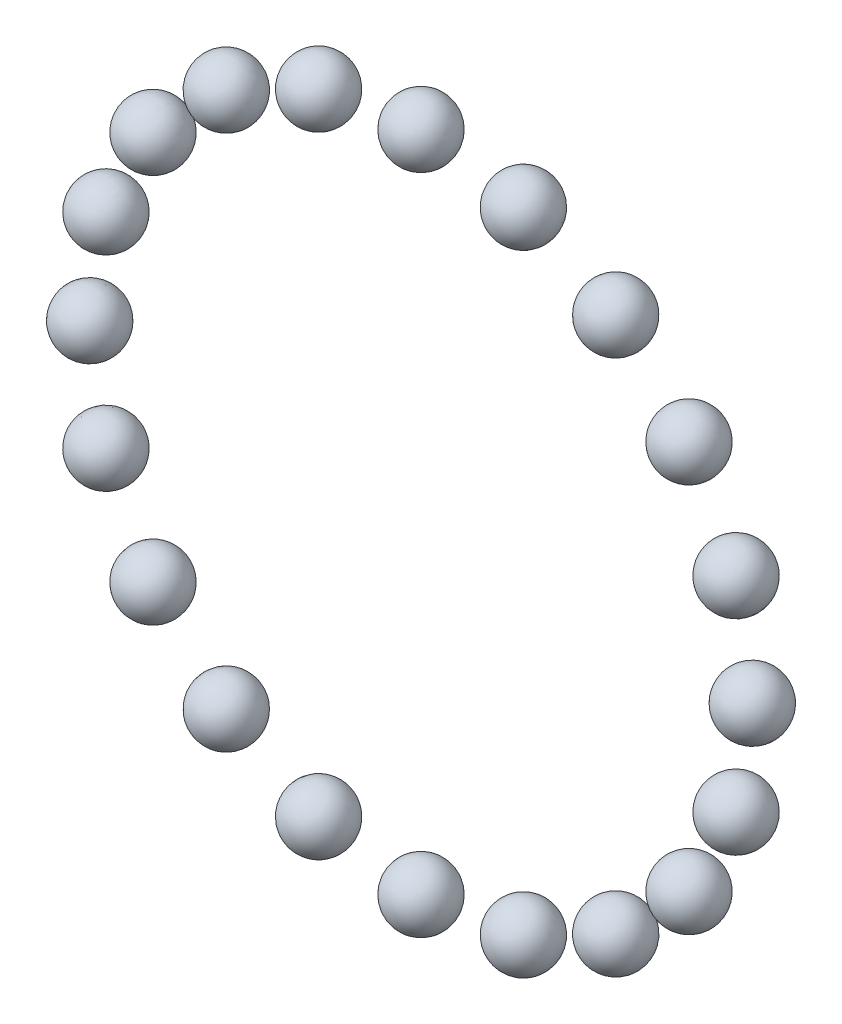
from build123d import *

# Parameters (mm, degrees)
CIRPATTERN1_COUNT = 20


with BuildPart() as part:
    # Sketch2 → Revolve1 (revolve)
    with BuildSketch(Plane.XY):
        with BuildLine():
            ThreePointArc((-29.5, 0), (-32.5, 3), (-35.5, 0))
            Line((-35.5, 0), (-29.5, 0))
        make_face()
    revolve(axis=Axis((-35.5, 0, 0), (1, 0, 0)))


with BuildPart() as cirpattern1_1:
    # CirPattern1: pattern copy
    add(part.part.rotate(Axis((0, 0, 0), (0, 0, 1)), 1 * 360 / CIRPATTERN1_COUNT))


with BuildPart() as cirpattern1_2:
    # CirPattern1: pattern copy
    add(part.part.rotate(Axis((0, 0, 0), (0, 0, 1)), 2 * 360 / CIRPATTERN1_COUNT))


with BuildPart() as cirpattern1_3:
    # CirPattern1: pattern copy
    add(part.part.rotate(Axis((0, 0, 0), (0, 0, 1)), 3 * 360 / CIRPATTERN1_COUNT))


with BuildPart() as cirpattern1_4:
    # CirPattern1: pattern copy
    add(part.part.rotate(Axis((0, 0, 0), (0, 0, 1)), 4 * 360 / CIRPATTERN1_COUNT))


with BuildPart() as cirpattern1_5:
    # CirPattern1: pattern copy
    add(part.part.rotate(Axis((0, 0, 0), (0, 0, 1)), 5 * 360 / CIRPATTERN1_COUNT))


with BuildPart() as cirpattern1_6:
    # CirPattern1: pattern copy
    add(part.part.rotate(Axis((0, 0, 0), (0, 0, 1)), 6 * 360 / CIRPATTERN1_COUNT))


with BuildPart() as cirpattern1_7:
    # CirPattern1: pattern copy
    add(part.part.rotate(Axis((0, 0, 0), (0, 0, 1)), 7 * 360 / CIRPATTERN1_COUNT))


with BuildPart() as cirpattern1_8:
    # CirPattern1: pattern copy
    add(part.part.rotate(Axis((0, 0, 0), (0, 0, 1)), 8 * 360 / CIRPATTERN1_COUNT))


with BuildPart() as cirpattern1_9:
    # CirPattern1: pattern copy
    add(part.part.rotate(Axis((0, 0, 0), (0, 0, 1)), 9 * 360 / CIRPATTERN1_COUNT))


with BuildPart() as cirpattern1_10:
    # CirPattern1: pattern copy
    add(part.part.rotate(Axis((0, 0, 0), (0, 0, 1)), 10 * 360 / CIRPATTERN1_COUNT))


with BuildPart() as cirpattern1_11:
    # CirPattern1: pattern copy
    add(part.part.rotate(Axis((0, 0, 0), (0, 0, 1)), 11 * 360 / CIRPATTERN1_COUNT))


with BuildPart() as cirpattern1_12:
    # CirPattern1: pattern copy
    add(part.part.rotate(Axis((0, 0, 0), (0, 0, 1)), 12 * 360 / CIRPATTERN1_COUNT))


with BuildPart() as cirpattern1_13:
    # CirPattern1: pattern copy
    add(part.part.rotate(Axis((0, 0, 0), (0, 0, 1)), 13 * 360 / CIRPATTERN1_COUNT))


with BuildPart() as cirpattern1_14:
    # CirPattern1: pattern copy
    add(part.part.rotate(Axis((0, 0, 0), (0, 0, 1)), 14 * 360 / CIRPATTERN1_COUNT))


with BuildPart() as cirpattern1_15:
    # CirPattern1: pattern copy
    add(part.part.rotate(Axis((0, 0, 0), (0, 0, 1)), 15 * 360 / CIRPATTERN1_COUNT))


with BuildPart() as cirpattern1_16:
    # CirPattern1: pattern copy
    add(part.part.rotate(Axis((0, 0, 0), (0, 0, 1)), 16 * 360 / CIRPATTERN1_COUNT))


with BuildPart() as cirpattern1_17:
    # CirPattern1: pattern copy
    add(part.part.rotate(Axis((0, 0, 0), (0, 0, 1)), 17 * 360 / CIRPATTERN1_COUNT))


with BuildPart() as cirpattern1_18:
    # CirPattern1: pattern copy
    add(part.part.rotate(Axis((0, 0, 0), (0, 0, 1)), 18 * 360 / CIRPATTERN1_COUNT))


with BuildPart() as cirpattern1_19:
    # CirPattern1: pattern copy
    add(part.part.rotate(Axis((0, 0, 0), (0, 0, 1)), 19 * 360 / CIRPATTERN1_COUNT))


solid = Compound([part.part, cirpattern1_1.part, cirpattern1_2.part, cirpattern1_3.part, cirpattern1_4.part, cirpattern1_5.part, cirpattern1_6.part, cirpattern1_7.part, cirpattern1_8.part, cirpattern1_9.part, cirpattern1_10.part, cirpattern1_11.part, cirpattern1_12.part, cirpattern1_13.part, cirpattern1_14.part, cirpattern1_15.part, cirpattern1_16.part, cirpattern1_17.part, cirpattern1_18.part, cirpattern1_19.part])
